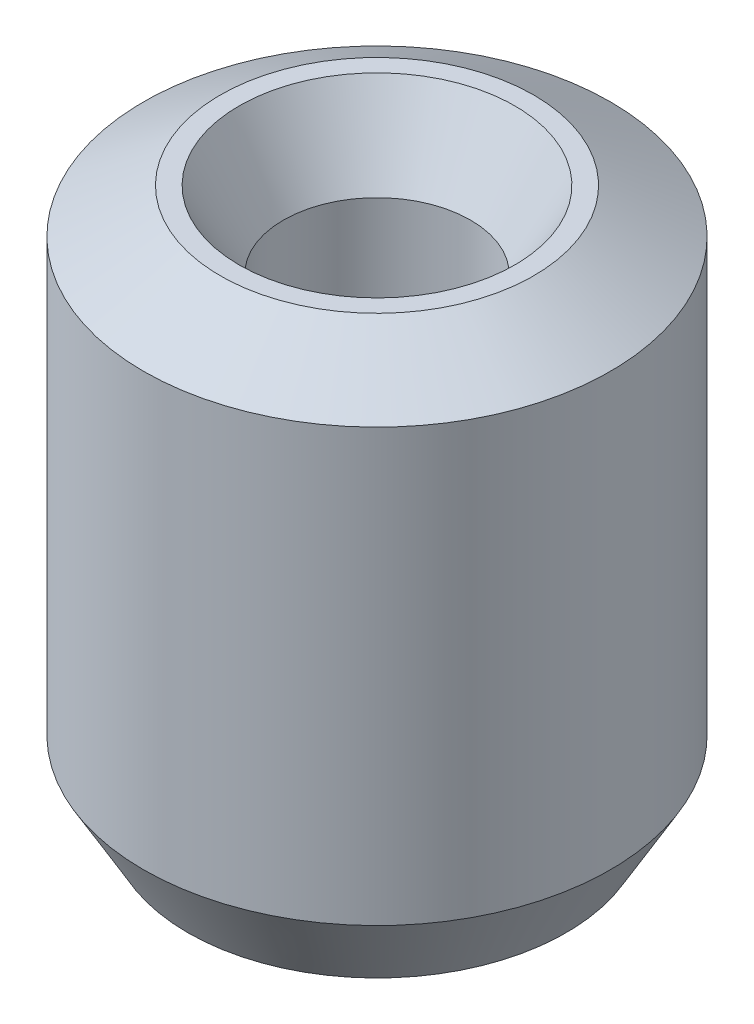
from build123d import *
from OCP.BRepFilletAPI import BRepFilletAPI_MakeChamfer

# Parameters (mm, degrees)
SKETCH1_R           = 10
BOSS_EXTRUDE1_DEPTH = 23.678442501
SKETCH2_R           = 4.006777671
CUT_EXTRUDE1_DEPTH  = 28.580221886
CHAMFER1_SIZE       = 1.898305624
CHAMFER1_SIZE2      = 3.287961789


with BuildPart() as part:
    # Sketch1 → Boss-Extrude1 (new body)
    with BuildSketch(Plane(origin=(0, 0, 0), x_dir=(1, 0, 0), z_dir=(0, 1, 0))):
        Circle(SKETCH1_R)
    extrude(amount=BOSS_EXTRUDE1_DEPTH)

    # Sketch2 → Cut-Extrude1 (cut, through all)
    with BuildSketch(Plane(origin=(0, 0, 0), x_dir=(1, 0, 0), z_dir=(0, 1, 0))):
        Circle(SKETCH2_R)
    extrude(amount=CUT_EXTRUDE1_DEPTH, mode=Mode.SUBTRACT)

    # Chamfer1: one chamfer whose edges measure the first distance from different faces: ONE call of the kernel's chamfer builder (chamfer() names one face for all edges)
    chamfer1_edges_1 = [part.edges().sort_by_distance(p)[0] for p in [
        (-4.006777671, 23.678442501, 0),
    ]]
    chamfer1_side_1 = [part.faces().sort_by_distance(p)[0] for p in [
        (-9.717157288, 23.678442501, 0),
    ]]
    chamfer1_edges_2 = [part.edges().sort_by_distance(p)[0] for p in [
        (-4.006777671, 0, 0),
    ]]
    chamfer1_side_2 = [part.faces().sort_by_distance(p)[0] for p in [
        (-4.006777671, 11.83922125, 0),
    ]]
    chamfer1_edges_3 = [part.edges().sort_by_distance(p)[0] for p in [
        (-10, 0, 0),
    ]]
    chamfer1_side_3 = [part.faces().sort_by_distance(p)[0] for p in [
        (-9.717157288, 0, 0),
    ]]
    chamfer1_edges_4 = [part.edges().sort_by_distance(p)[0] for p in [
        (-10, 23.678442501, 0),
    ]]
    chamfer1_side_4 = [part.faces().sort_by_distance(p)[0] for p in [
        (-10, 11.83922125, 0),
    ]]
    chamfer1 = BRepFilletAPI_MakeChamfer(part.part.solid().wrapped)
    for e in chamfer1_edges_1:
        chamfer1.Add(CHAMFER1_SIZE, CHAMFER1_SIZE2, e.wrapped, chamfer1_side_1[0].wrapped)  # the first distance lies on this face
    for e in chamfer1_edges_2:
        chamfer1.Add(CHAMFER1_SIZE, CHAMFER1_SIZE2, e.wrapped, chamfer1_side_2[0].wrapped)  # the first distance lies on this face
    for e in chamfer1_edges_3:
        chamfer1.Add(CHAMFER1_SIZE, CHAMFER1_SIZE2, e.wrapped, chamfer1_side_3[0].wrapped)  # the first distance lies on this face
    for e in chamfer1_edges_4:
        chamfer1.Add(CHAMFER1_SIZE, CHAMFER1_SIZE2, e.wrapped, chamfer1_side_4[0].wrapped)  # the first distance lies on this face
    add(Compound.cast(chamfer1.Shape()), mode=Mode.REPLACE)


solid = part.part
